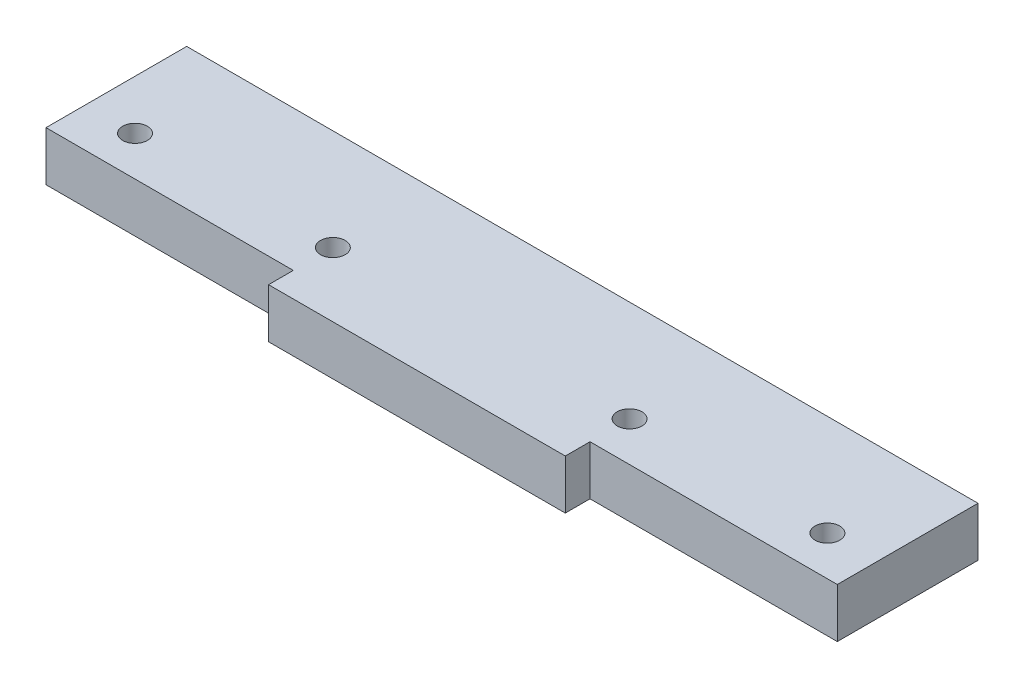
from build123d import *

# Parameters (mm, degrees)
SKETCH2_W           = 160
SKETCH2_H           = 28.45
BOSS_EXTRUDE1_DEPTH = 10
SKETCH4_W           = 60
SKETCH4_H           = 10
BOSS_EXTRUDE2_DEPTH = 5
SKETCH5_R           = 2.5
CUT_EXTRUDE1_DEPTH  = 83.883053907


with BuildPart() as part:
    # Sketch2 → Boss-Extrude1 (new body)
    with BuildSketch(Plane(origin=(0, 0, 0), x_dir=(1, 0, 0), z_dir=(0, 1, 0))):
        Rectangle(SKETCH2_W, SKETCH2_H)
    extrude(amount=BOSS_EXTRUDE1_DEPTH)

    # Sketch4 → Boss-Extrude2 (add)
    with BuildSketch(Plane.XY.offset(14.225)):
        with Locations((0, 5)):
            Rectangle(SKETCH4_W, SKETCH4_H)
    extrude(amount=BOSS_EXTRUDE2_DEPTH)

    # Sketch5 → Cut-Extrude1 (cut, through all)
    with BuildSketch(Plane(origin=(0, 10, 0), x_dir=(1, 0, 0), z_dir=(0, 1, 0))):
        with Locations((70, -6.225)):
            Circle(SKETCH5_R)
        with Locations((30, -6.225)):
            Circle(SKETCH5_R)
        with Locations((-30, -6.225)):
            Circle(SKETCH5_R)
        with Locations((-70, -6.225)):
            Circle(SKETCH5_R)
    extrude(amount=-CUT_EXTRUDE1_DEPTH, mode=Mode.SUBTRACT)


solid = part.part
